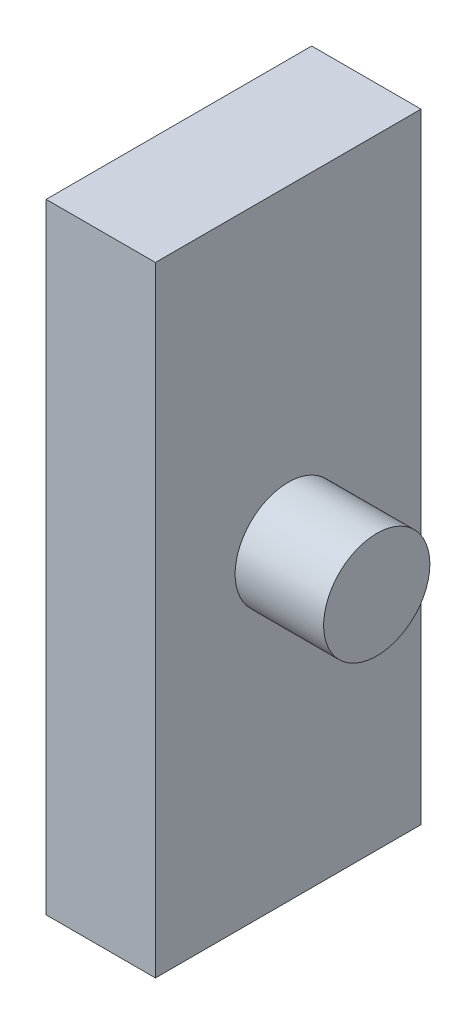
from build123d import *

# Parameters (mm, degrees)
SKETCH1_W           = 15
SKETCH1_H           = 35
SKETCH1_W_2         = 3.375
SKETCH1_H_2         = 17
BOSS_EXTRUDE1_DEPTH = 4.175
SKETCH2_W           = 15
SKETCH2_H           = 35
BOSS_EXTRUDE2_DEPTH = 2
SKETCH3_R           = 3
BOSS_EXTRUDE3_DEPTH = 5


with BuildPart() as part:
    # Sketch1 → Boss-Extrude1 (new body)
    with BuildSketch(Plane(origin=(0, 0, 0), x_dir=(0, 0, -1), z_dir=(1, 0, 0))):
        with Locations((7.5, 17.5)):
            Rectangle(SKETCH1_W, SKETCH1_H)
        with Locations((7.5, 17.5)):
            Rectangle(SKETCH1_W_2, SKETCH1_H_2, mode=Mode.SUBTRACT)
    extrude(amount=BOSS_EXTRUDE1_DEPTH)

    # Sketch2 → Boss-Extrude2 (add)
    with BuildSketch(Plane(origin=(4.175, 0, 0), x_dir=(0, 0, -1), z_dir=(1, 0, 0))):
        with Locations((7.5, 17.5)):
            Rectangle(SKETCH2_W, SKETCH2_H)
    extrude(amount=BOSS_EXTRUDE2_DEPTH)

    # Sketch3 → Boss-Extrude3 (add)
    with BuildSketch(Plane(origin=(6.175, 0, 0), x_dir=(0, 0, -1), z_dir=(1, 0, 0))):
        with Locations((7.5, 17.5)):
            Circle(SKETCH3_R)
    extrude(amount=BOSS_EXTRUDE3_DEPTH)


solid = part.part
